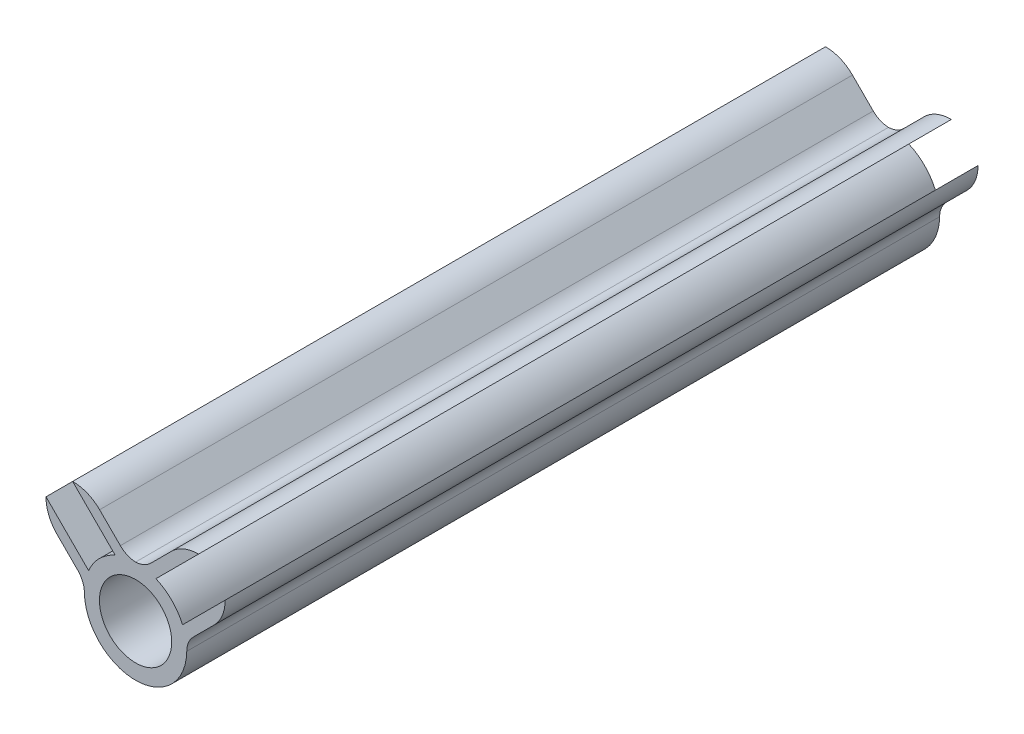
from build123d import *

# Parameters (mm, degrees)
SKETCH1_R                   = 6.8
SKETCH1_R_2                 = 4.8
TUBE_SURROUNDING_DEPTH      = 50
FIN_START                   = -100
FIN_HOLDERS_DEPTH           = 100
F_3MM_SUPPORT_FILLETS_R     = 3
F_5MM_FIN_HOLDER_ROUNDING_R = 5


with BuildPart() as part:
    # Sketch1 → Tube surrounding (new, symmetric)
    with BuildSketch(Plane.XY):
        Circle(SKETCH1_R)
        Circle(SKETCH1_R_2, mode=Mode.SUBTRACT)
    extrude(amount=TUBE_SURROUNDING_DEPTH, both=True)

    # Sketch2 → Fin holders (add)
    with BuildSketch(Plane.XY.offset(50).offset(FIN_START)):
        with BuildLine():
            Line((-6.239343856, 2.70380995), (-2.70380995, 6.239343856))
            Line((-2.70380995, 6.239343856), (-8.3606642, 11.896198106))
            Line((-8.3606642, 11.896198106), (-7.300004028, 12.956858277))
            Line((-7.300004028, 12.956858277), (0, 5.656854249))
            Line((0, 5.656854249), (7.300004028, 12.956858277))
            Line((7.300004028, 12.956858277), (8.3606642, 11.896198106))
            Line((8.3606642, 11.896198106), (2.70380995, 6.239343856))
            Line((2.70380995, 6.239343856), (6.239343856, 2.70380995))
            Line((6.239343856, 2.70380995), (11.896198106, 8.3606642))
            Line((11.896198106, 8.3606642), (12.956858277, 7.300004028))
            Line((12.956858277, 7.300004028), (4.704593429, -0.952260821))
            ThreePointArc((4.704593429, -0.952260821), (0, 4.8), (-4.704593429, -0.952260821))
            Line((-4.704593429, -0.952260821), (-12.956858277, 7.300004028))
            Line((-12.956858277, 7.300004028), (-11.896198106, 8.3606642))
            Line((-11.896198106, 8.3606642), (-6.239343856, 2.70380995))
        make_face()
    extrude(amount=FIN_HOLDERS_DEPTH)

    # 3mm support fillets
    # the kernel refuses this fillet: 3 mm, written as the material it adds along each edge
    with BuildSketch(Plane(origin=(1.060017294, 6.716871544, -50), x_dir=(-0.9973250573829818, 0.07309398002593596, 0), z_dir=(0, 0, 1)), Plane(origin=(-6.716871544, 1.060017294, -50), x_dir=(-0.07309398002594036, -0.9973250573829815, 0), z_dir=(0, 0, 1))) as f_3mm_support_fillets_piece_1:
        with BuildLine():
            CenterArc((1.38224034, -2.989581697), F_3MM_SUPPORT_FILLETS_R, 94.776406165, 44.415308597)
            Line((-0.88846134, -1.028991511), (0, 0))
            ThreePointArc((0, 0), (0.566218934, -0.023614819), (1.132437869, 0))
        make_face()
    extrude(amount=100)
    with BuildSketch(Plane(origin=(-1.060017294, 6.716871544, -50), x_dir=(-0.7071067811865461, 0.707106781186549, 0), z_dir=(0, 0, 1)), Plane(origin=(6.716871544, 1.060017294, -50), x_dir=(0.7071067811865486, 0.7071067811865466, 0), z_dir=(0, 0, 1))) as f_3mm_support_fillets_piece_2:
        with BuildLine():
            CenterArc((1.359480446, -3), F_3MM_SUPPORT_FILLETS_R, 90, 44.415308597)
            ThreePointArc((-0.740082191, -0.857142857), (-0.352167026, -0.444004423), (0, 0))
            Line((0, 0), (1.359480446, 0))
        make_face()
    extrude(amount=100)

    # 5mm fin holder rounding
    # the kernel refuses this fillet: 5 mm, written as the material it takes off along each edge
    with BuildSketch(Plane(origin=(12.956858277, 7.300004028, -58.926785536), x_dir=(-0.707106781186548, -0.7071067811865471, 0), z_dir=(0, 0, 1)), Plane(origin=(-7.300004028, 12.956858277, -58.926785536), x_dir=(0.7071067811865471, -0.707106781186548, 0), z_dir=(0, 0, 1))) as f_5mm_fin_holder_rounding_piece_1:
        with BuildLine():
            CenterArc((3.570714214, -5), F_5MM_FIN_HOLDER_ROUNDING_R, 90, 45.572995999)
            Line((0, -1.5), (-0.071414284, -1.43))
            ThreePointArc((-0.071414284, -1.43), (-0.1, -0.75), (-0.1, 0))
            Line((-0.1, 0), (0, 0.1))
            Line((0, 0.1), (3.570714214, 0.1))
            Line((3.570714214, 0.1), (3.570714214, 0))
        make_face()
    extrude(amount=117.853571071, mode=Mode.SUBTRACT)
    with BuildSketch(Plane(origin=(-12.956858277, 7.300004028, -58.926785536), x_dir=(0.7071067811865476, 0.7071067811865476, 0), z_dir=(0, 0, 1))) as f_5mm_fin_holder_rounding_piece_2:
        with BuildLine():
            CenterArc((5, -3.570714214), F_5MM_FIN_HOLDER_ROUNDING_R, 134.427004001, 45.572995999)
            Line((0, -3.570714214), (-0.1, -3.570714214))
            Line((-0.1, -3.570714214), (-0.1, 0))
            Line((-0.1, 0), (0, 0.1))
            ThreePointArc((0, 0.1), (0.75, 0.1), (1.43, 0.071414284))
            Line((1.43, 0.071414284), (1.5, 0))
        make_face()
    extrude(amount=117.853571071, mode=Mode.SUBTRACT)
    with BuildSketch(Plane(origin=(7.300004028, 12.956858277, -58.926785536), x_dir=(-0.707106781186548, -0.707106781186547, 0), z_dir=(0, 0, 1))) as f_5mm_fin_holder_rounding_piece_3:
        with BuildLine():
            CenterArc((3.570714214, 5), F_5MM_FIN_HOLDER_ROUNDING_R, 224.427004001, 45.572995999)
            Line((0, 1.5), (-0.071414284, 1.43))
            ThreePointArc((-0.071414284, 1.43), (-0.1, 0.75), (-0.1, 0))
            Line((-0.1, 0), (0, -0.1))
            Line((0, -0.1), (3.570714214, -0.1))
            Line((3.570714214, -0.1), (3.570714214, 0))
        make_face()
    extrude(amount=117.853571071, mode=Mode.SUBTRACT)


solid = part.part
